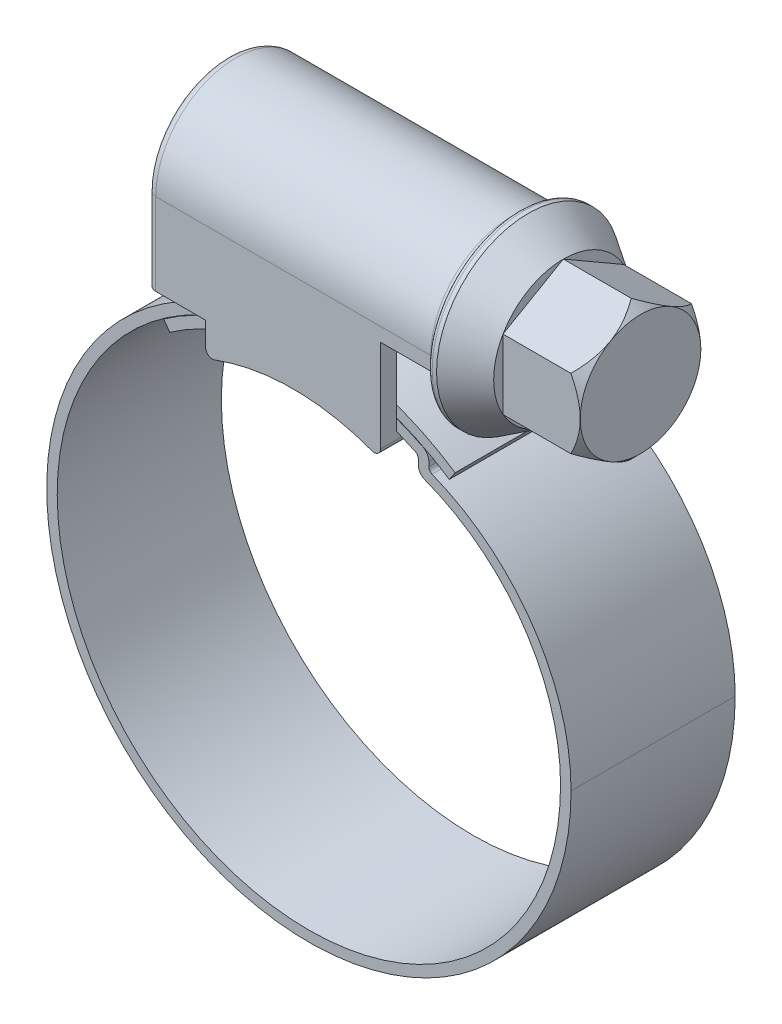
from build123d import *

# Parameters (mm, degrees)
EXTRUDE_THIN1_DEPTH      = 4.7625
BOSS_EXTRUDE1_DEPTH      = 8.48845
BOSS_EXTRUDE1_DEPTH_BACK = 8.48845
SHELL2_START             = -7.57845
SHELL2_DEPTH             = 15.1569
BOSS_EXTRUDE2_DEPTH      = 5.6725
BOSS_EXTRUDE2_DEPTH_BACK = 6.3921
BOSS_EXTRUDE9_START      = -0.91
BOSS_EXTRUDE9_DEPTH      = 0.91
BOSS_EXTRUDE10_START     = 0.91
BOSS_EXTRUDE10_DEPTH     = 0.91
CUT_EXTRUDE3_DEPTH       = 29.83483606
CUT_EXTRUDE3_DEPTH_BACK  = 29.83483606
FILLET3_R                = 0.509307
FILLET8_R                = 1.018614
CHAMFER2_SIZE            = 0.762
SKETCH31_W               = 0.91
SKETCH31_H               = 2.38125
BOSS_EXTRUDE7_DEPTH      = 7.0231
SKETCH15_OUTSIDE_W       = 105.793
SKETCH15_OUTSIDE_H       = 131.379
SKETCH15_OUTSIDE_R       = 3.5
CUT_EXTRUDE1_DEPTH       = 40.294529025
CUT_EXTRUDE1_DRAFT       = -45
FILLET6_R                = 0.254
CUT_EXTRUDE4_DEPTH       = 30.542716285
CUT_EXTRUDE4_DEPTH_BACK  = 30.542716285
SKETCH35_W               = 3.40845
SKETCH35_H               = 3.96875
FILLET7_R                = 0.381
FILLET9_R                = 0.3048
FILLET10_R               = 0.6096


# Read off the part's stored shape, not the designer's step: Shell2
with BuildPart() as part:
    # Sketch2 → Extrude-Thin1 (new, symmetric)
    with BuildSketch(Plane.XY):
        with BuildLine():
            ThreePointArc((-8.073250699, 11.401031671), (-1.006993193, 13.933659416), (6.35, 12.443407893))
            Line((6.35, 12.443407893), (6.35, 11.529007893))
            ThreePointArc((6.35, 11.529007893), (12.328469538, 7.089835118), (14.605, 0))
            ThreePointArc((14.605, 0), (-12.890163033, -6.866565516), (8.148345159, 12.120664015))
            Line((8.148345159, 12.120664015), (8.48845, 12.626569992))
            ThreePointArc((8.48845, 12.626569992), (-13.428187229, -7.153169989), (15.2146, 0))
            ThreePointArc((15.2146, 0), (12.950402415, 7.265114314), (6.9596, 11.957529804))
            Line((6.9596, 11.957529804), (6.9596, 12.811272536))
            ThreePointArc((6.9596, 12.811272536), (-0.863433685, 14.55401039), (-8.425538002, 11.898531234))
            Line((-8.425538002, 11.898531234), (-8.073250699, 11.401031671))
        make_face()
    extrude(amount=EXTRUDE_THIN1_DEPTH, both=True)

    # Fillet9
    fillet9_edges = [part.edges().sort_by_distance(p)[0] for p in [
        (6.35, 12.443407893, 0),
        (6.9596, 11.957529804, 0),
    ]]
    fillet(fillet9_edges, radius=FILLET9_R)

    # Fillet10
    fillet10_edges = [part.edges().sort_by_distance(p)[0] for p in [
        (6.35, 11.529007893, 0),
        (6.9596, 12.811272536, 0),
    ]]
    fillet(fillet10_edges, radius=FILLET10_R)


with BuildPart() as body_2:
    # Sketch3 → Boss-Extrude1 (new, two sides: drawn at the far end of the back side and taken through both)
    with BuildSketch(Plane(origin=(0, 0, 0), x_dir=(0, 0, -1), z_dir=(1, 0, 0)).offset(-BOSS_EXTRUDE1_DEPTH_BACK)):
        with BuildLine():
            Line((-5.6725, 15.2146), (-5.6725, 13.96335))
            Line((-5.6725, 13.96335), (-4.7625, 13.96335))
            Line((-4.7625, 13.96335), (-4.7625, 15.2146))
            Line((-4.7625, 15.2146), (6.4175, 15.2146))
            Line((6.4175, 15.2146), (6.4175, 13.96335))
            Line((6.4175, 13.96335), (7.3275, 13.96335))
            Line((7.3275, 13.96335), (7.3275, 15.2146))
            Line((7.3275, 15.2146), (7.3275, 17.13835))
            Line((7.3275, 17.13835), (3.619930574, 17.13835))
            Line((3.619930574, 17.13835), (3.619930574, 18.726235616))
            ThreePointArc((3.619930574, 18.726235616), (-1.026284713, 23.372450903), (-5.6725, 18.726235616))
            Line((-5.6725, 18.726235616), (-5.6725, 17.13835))
            Line((-5.6725, 17.13835), (-5.6725, 15.2146))
        make_face()
    extrude(amount=BOSS_EXTRUDE1_DEPTH + BOSS_EXTRUDE1_DEPTH_BACK)

    # Shell2 outline → Shell2 (cut)
    with BuildSketch(Plane.YZ.offset(SHELL2_START)):
        with BuildLine():
            Line((15.2146, -6.4175), (16.22835, -6.4175))
            Line((16.22835, -6.4175), (16.22835, -2.709930574))
            Line((16.22835, -2.709930574), (18.726235616, -2.709930574))
            ThreePointArc((18.726235616, -2.709930574), (22.462450903, 1.026284713), (18.726235616, 4.7625))
            Line((18.726235616, 4.7625), (15.2146, 4.7625))
            Line((15.2146, 4.7625), (15.2146, -6.4175))
        make_face()
    extrude(amount=SHELL2_DEPTH, mode=Mode.SUBTRACT)


with BuildPart() as body_3:
    # Sketch4 → Boss-Extrude2 (new, two sides: drawn at the far end of the back side and taken through both)
    with BuildSketch(Plane.XY.offset(-BOSS_EXTRUDE2_DEPTH_BACK)):
        with BuildLine():
            Line((-5.08, 12.02221364), (-5.08, 13.013627473))
            ThreePointArc((-5.08, 13.013627473), (0, 13.97), (5.08, 13.013627473))
            Line((5.08, 13.013627473), (5.08, 12.02221364))
            ThreePointArc((5.08, 12.02221364), (0, 13.0514375), (-5.08, 12.02221364))
        make_face()
    extrude(amount=BOSS_EXTRUDE2_DEPTH + BOSS_EXTRUDE2_DEPTH_BACK)


    add(body_2.part)  # Boss-Extrude9 merges body 2
    # Sketch6 → Boss-Extrude9 (add)
    with BuildSketch(Plane(origin=(0, 0, 4.7625), x_dir=(-1, 0, 0), z_dir=(0, 0, -1)).offset(BOSS_EXTRUDE9_START)):
        with BuildLine():
            Line((-5.08, 13.013627473), (-5.08, 16.22835))
            Line((-5.08, 16.22835), (5.08, 16.22835))
            Line((5.08, 16.22835), (5.08, 13.013627473))
            ThreePointArc((5.08, 13.013627473), (0, 13.97), (-5.08, 13.013627473))
        make_face()
    extrude(amount=BOSS_EXTRUDE9_DEPTH)

    # Sketch7 → Boss-Extrude10 (add)
    with BuildSketch(Plane.XY.offset(-6.3921).offset(BOSS_EXTRUDE10_START)):
        with BuildLine():
            Line((5.08, 16.20295), (-5.08, 16.20295))
            Line((-5.08, 16.20295), (-5.08, 13.013627473))
            ThreePointArc((-5.08, 13.013627473), (0, 13.97), (5.08, 13.013627473))
            Line((5.08, 13.013627473), (5.08, 16.20295))
        make_face()
    extrude(amount=-BOSS_EXTRUDE10_DEPTH)

    # Sketch25 → Cut-Extrude3 (cut, two sides: drawn at the far end of the back side and taken through both)
    with BuildSketch(Plane(origin=(0, 0, 0), x_dir=(0, 0, -1), z_dir=(1, 0, 0)).offset(-CUT_EXTRUDE3_DEPTH_BACK)):
        with BuildLine():
            Line((-3.407534713, 18.726235616), (-3.407534713, 15.2146))
            Line((-3.407534713, 15.2146), (1.354965287, 15.2146))
            Line((1.354965287, 15.2146), (1.354965287, 18.726235616))
            ThreePointArc((1.354965287, 18.726235616), (-1.026284713, 21.107485616), (-3.407534713, 18.726235616))
        make_face()
    extrude(amount=CUT_EXTRUDE3_DEPTH + CUT_EXTRUDE3_DEPTH_BACK, mode=Mode.SUBTRACT)

    # Fillet3
    fillet3_edges = [body_3.edges().sort_by_distance(p)[0] for p in [
        (-8.48845, 16.344792808, 5.6725),
        (-8.48845, 23.372450903, 1.026284713),
        (-8.48845, 17.932292808, -3.619930574),
        (0, 17.13835, -3.619930574),
        (-8.48845, 17.13835, -5.473715287),
        (0, 17.13835, -7.3275),
        (-8.48845, 15.55085, -7.3275),
        (8.48845, 16.344792808, 5.6725),
        (8.48845, 17.13835, -5.473715287),
        (8.48845, 17.932292808, -3.619930574),
        (8.48845, 23.372450903, 1.026284713),
    ]]
    fillet(fillet3_edges, radius=FILLET3_R)

    # Fillet8
    fillet8_edges = [body_3.edges().sort_by_distance(p)[0] for p in [
        (8.03345, 15.2146, -1.354965287),
        (-8.03345, 15.2146, -1.354965287),
        (8.03345, 15.2146, 3.407534713),
        (-8.03345, 15.2146, 3.407534713),
    ]]
    fillet(fillet8_edges, radius=FILLET8_R)

    # Sketch35 → Cut-Extrude4 (cut, two sides: drawn at the far end of the back side and taken through both)
    with BuildSketch(Plane.XY.offset(-CUT_EXTRUDE4_DEPTH_BACK)):
        with Locations((6.784225, 15.947725)):
            Rectangle(SKETCH35_W, SKETCH35_H)
    extrude(amount=CUT_EXTRUDE4_DEPTH + CUT_EXTRUDE4_DEPTH_BACK, mode=Mode.SUBTRACT)

    # Fillet7
    fillet7_edges = [body_3.edges().sort_by_distance(p)[0] for p in [
        (-5.08, 12.02221364, -0.3598),
        (5.08, 12.02221364, -0.3598),
    ]]
    fillet(fillet7_edges, radius=FILLET7_R)


with BuildPart() as body_3_2:
    # Sketch10 → Revolve1 (revolve)
    with BuildSketch(Plane.XY.offset(1.026284713)):
        Polygon((-7.57845, 16.344985616), (-7.57845, 18.726235616), (7.57845, 18.726235616), (7.57845, 16.344985616), (7.57845, 15.2146), (-7.57845, 15.2146), align=None)
    revolve(axis=Axis((-7.57845, 18.726235616, 1.026284713), (1, 0, 0)))

    # Chamfer2
    chamfer2_edges = [body_3_2.edges().sort_by_distance(p)[0] for p in [
        (-7.57845, 22.237871231, 1.026284713),
        (7.57845, 22.237871231, 1.026284713),
    ]]
    chamfer(chamfer2_edges, length=CHAMFER2_SIZE)

    # Sketch31 → Revolve3 (revolve)
    with BuildSketch(Plane.XY.offset(1.026284713), mode=Mode.PRIVATE) as revolve3_sk:
        with Locations((-8.03345, 17.535610616)):
            Rectangle(SKETCH31_W, SKETCH31_H)
        with Locations((8.03345, 17.535610616)):
            Rectangle(SKETCH31_W, SKETCH31_H)
    revolve(revolve3_sk.sketch.rotate(Axis((8.48845, 18.726235616, 1.026284713), (-1, 0, 0)), 270), axis=Axis((8.48845, 18.726235616, 1.026284713), (-1, 0, 0)))

    # Sketch13 → Boss-Extrude7 (add)
    with BuildSketch(Plane(origin=(8.48845, 0, 0), x_dir=(0, 0, -1), z_dir=(1, 0, 0))):
        Polygon((-1.026284713, 22.7676875), (-4.526284713, 20.746961558), (-4.526284713, 16.705509674), (-1.026284713, 14.684783731), (2.473715287, 16.705509674), (2.473715287, 20.746961558), align=None)
    extrude(amount=BOSS_EXTRUDE7_DEPTH)


with BuildPart() as cut_extrude1_tool:
    # Sketch15 outside → Cut-Extrude1 (with draft: the straight prism first)
    with BuildSketch(Plane(origin=(15.51155, 0, 0), x_dir=(0, 0, -1), z_dir=(1, 0, 0))):
        with Locations((0.8275, 4.0785)):
            Rectangle(SKETCH15_OUTSIDE_W, SKETCH15_OUTSIDE_H)
        with Locations((-1.026284713, 18.726235616)):
            Circle(SKETCH15_OUTSIDE_R, mode=Mode.SUBTRACT)
    extrude(amount=-CUT_EXTRUDE1_DEPTH)
    # Cut-Extrude1: the draft: its side faces are tilted about the plane it starts from
    cut_extrude1_sides = [cut_extrude1_tool.faces().sort_by_distance(p)[0] for p in [
        (-4.635714512, -61.611, -0.8275),
        (-4.635714512, 4.0785, -53.724),
        (-4.635714512, 69.768, -0.8275),
        (-4.635714512, 4.0785, 52.069),
        (-4.635714512, 18.726235616, 4.526284713),
    ]]
    draft(cut_extrude1_sides, Plane(origin=(15.51155, 0, 0), x_dir=(0, 0, -1), z_dir=(1, 0, 0)), CUT_EXTRUDE1_DRAFT)


with BuildPart() as body_3_2_1:
    add(body_3_2.part)

    # Cut-Extrude1: cut by cut_extrude1_tool
    add(cut_extrude1_tool.part, mode=Mode.SUBTRACT)

    # Sketch19 → Revolve2 (revolve)
    with BuildSketch(Plane.XY.offset(1.026284713)):
        Polygon((11.02845, 18.726235616), (11.02845, 22.7676875), (8.99645, 24.0514375), (8.48845, 24.0514375), (8.48845, 18.726235616), align=None)
    revolve(axis=Axis((8.48845, 18.726235616, 1.026284713), (1, 0, 0)))

    # Fillet6
    fillet6_edges = [body_3_2_1.edges().sort_by_distance(p)[0] for p in [
        (8.48845, 13.401033731, 1.026284713),
    ]]
    fillet(fillet6_edges, radius=FILLET6_R)


solid = Compound([part.part, body_3.part, body_3_2_1.part])
